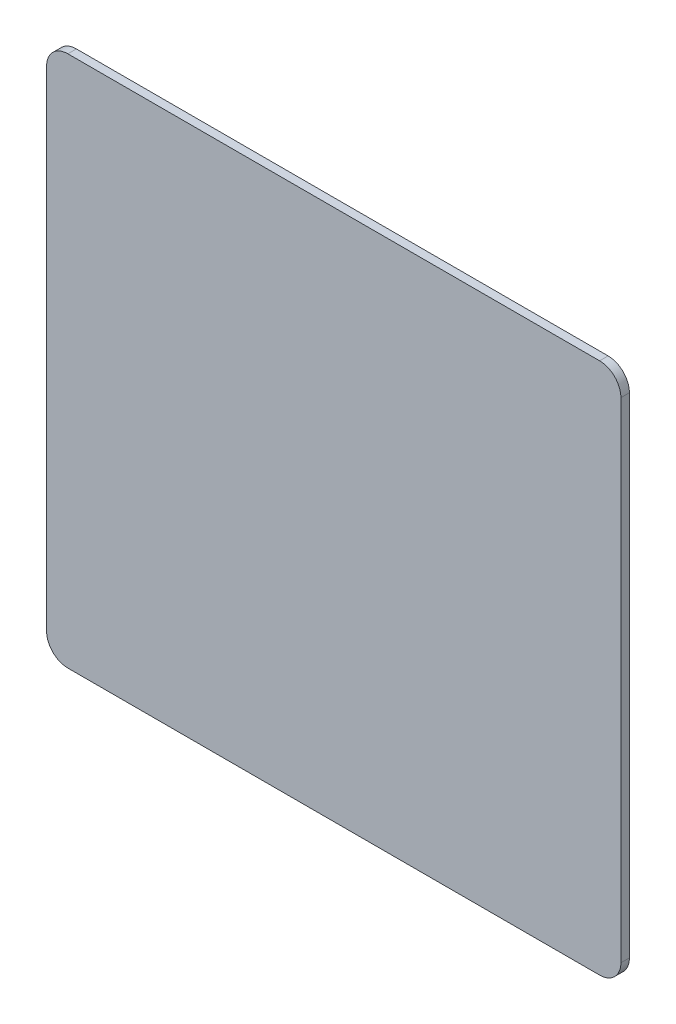
from build123d import *

# Parameters (mm, degrees)
SKETCH1_W           = 215.9
SKETCH1_H           = 200
BOSS_EXTRUDE1_DEPTH = 3.2
FILLET1_R           = 8


with BuildPart() as part:
    # Sketch1 → Boss-Extrude1 (new body)
    with BuildSketch(Plane.XY):
        Rectangle(SKETCH1_W, SKETCH1_H)
    extrude(amount=BOSS_EXTRUDE1_DEPTH)

    # Fillet1
    fillet1_edges = [part.edges().sort_by_distance(p)[0] for p in [
        (107.95, -100, 1.6),
        (107.95, 100, 1.6),
        (-107.95, 100, 1.6),
        (-107.95, -100, 1.6),
    ]]
    fillet(fillet1_edges, radius=FILLET1_R)


solid = part.part
